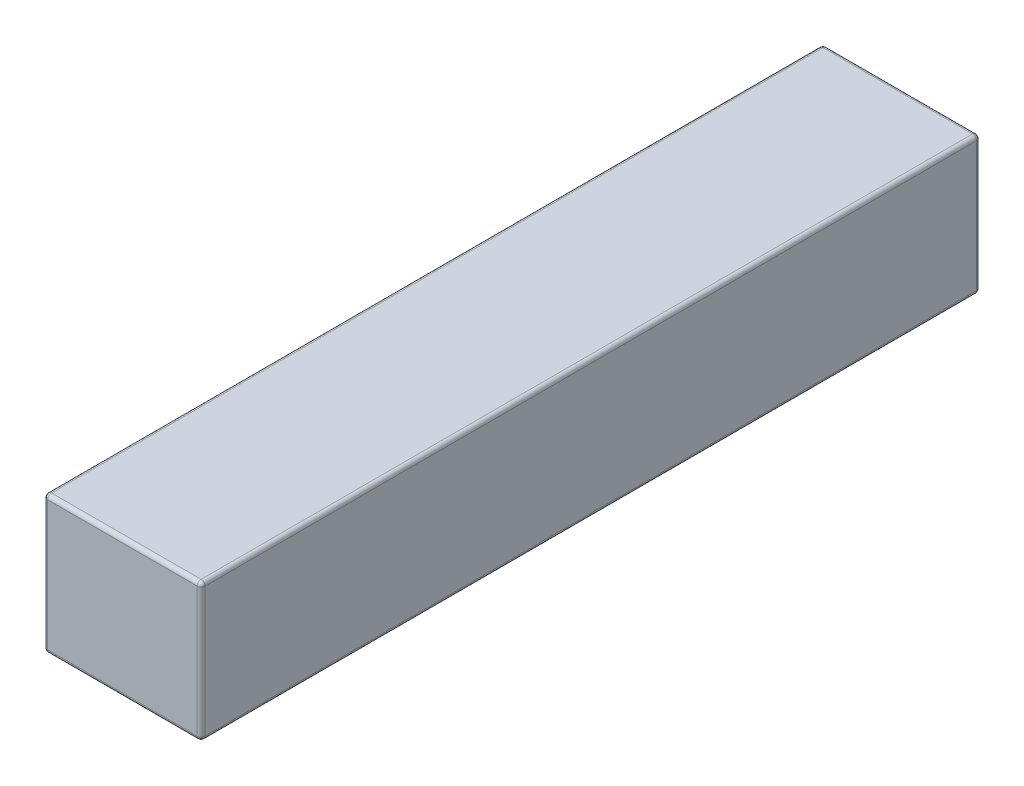
from build123d import *

# Parameters (mm, degrees)
SKETCH1_W           = 400
SKETCH1_H           = 350
BOSS_EXTRUDE1_DEPTH = 1980
FILLET1_R           = 10


with BuildPart() as part:
    # Sketch1 → Boss-Extrude1 (new body)
    with BuildSketch(Plane.XY):
        Rectangle(SKETCH1_W, SKETCH1_H)
    extrude(amount=BOSS_EXTRUDE1_DEPTH)

    # Fillet1
    fillet1_edges = [part.edges().sort_by_distance(p)[0] for p in [
        (-200, -175, 990),
        (200, -175, 990),
        (200, 175, 990),
        (-200, 175, 990),
        (0, 175, 1980),
        (200, 0, 1980),
        (0, -175, 1980),
        (-200, 0, 1980),
        (0, 175, 0),
        (200, 0, 0),
        (0, -175, 0),
        (-200, 0, 0),
    ]]
    fillet(fillet1_edges, radius=FILLET1_R)


solid = part.part
